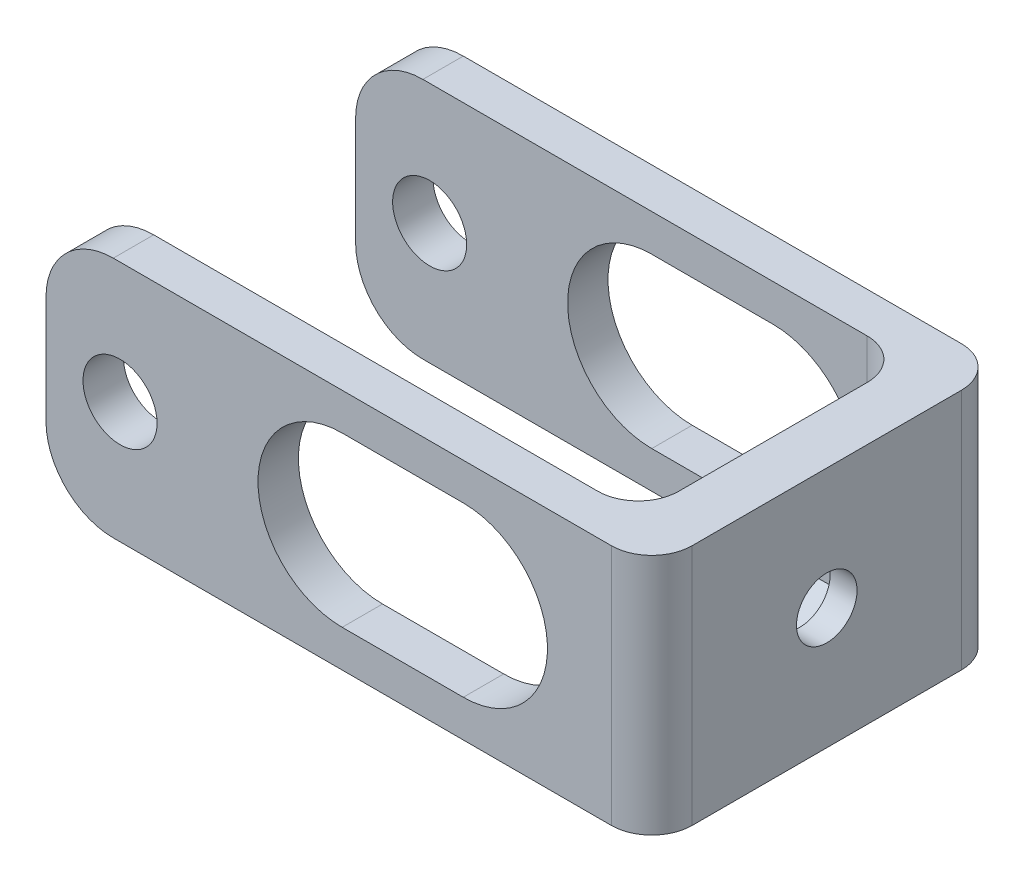
from build123d import *

# Parameters (mm, degrees)
SKETCH1_W           = 26
SKETCH1_H           = 18
BOSS_EXTRUDE1_DEPTH = 4
SKETCH2_W           = 3
SKETCH2_H           = 18
BOSS_EXTRUDE2_DEPTH = 41
SKETCH3_R           = 2.75
CUT_EXTRUDE1_DEPTH  = 50.376107583
FILLET1_R           = 3
FILLET2_R           = 5
SKETCH5_R           = 7
BOSS_EXTRUDE3_DEPTH = 2
CUT_EXTRUDE3_REACH  = 49.697
SKETCH7_R           = 2.25
CUT_EXTRUDE4_DEPTH  = 4
CHAMFER1_SIZE       = 2
CUT_EXTRUDE5_DEPTH  = 50.376107601


with BuildPart() as part:
    # Sketch1 → Boss-Extrude1 (new body)
    with BuildSketch(Plane(origin=(0, 0, 0), x_dir=(0, 0, -1), z_dir=(1, 0, 0))):
        Rectangle(SKETCH1_W, SKETCH1_H)
    extrude(amount=BOSS_EXTRUDE1_DEPTH)

    # Sketch2 → Boss-Extrude2 (add)
    with BuildSketch(Plane.ZY):
        with Locations((-11.5, 0)):
            Rectangle(SKETCH2_W, SKETCH2_H)
        with Locations((11.5, 0)):
            Rectangle(SKETCH2_W, SKETCH2_H)
    extrude(amount=BOSS_EXTRUDE2_DEPTH)

    # Sketch3 → Cut-Extrude1 (cut, through all)
    with BuildSketch(Plane.XY.offset(13)):
        with Locations((-35.5, 0)):
            Circle(SKETCH3_R)
    extrude(amount=-CUT_EXTRUDE1_DEPTH, mode=Mode.SUBTRACT)

    # Fillet1
    fillet1_edges = [part.edges().sort_by_distance(p)[0] for p in [
        (4, 0, 13),
        (0, 0, -10),
        (0, 0, 10),
        (4, 0, -13),
    ]]
    fillet(fillet1_edges, radius=FILLET1_R)

    # Fillet2
    fillet2_edges = [part.edges().sort_by_distance(p)[0] for p in [
        (-41, -9, -11.5),
        (-41, 9, -11.5),
        (-41, 9, 11.5),
        (-41, -9, 11.5),
    ]]
    fillet(fillet2_edges, radius=FILLET2_R)

    # Sketch5 → Boss-Extrude3 (add)
    with BuildSketch(Plane.ZY):
        Circle(SKETCH5_R)
    extrude(amount=BOSS_EXTRUDE3_DEPTH)

    # Sketch7 → Cut-Extrude3 (cut, up to next)
    with BuildSketch(Plane(origin=(4, 0, 0), x_dir=(0, 0, -1), z_dir=(1, 0, 0)), mode=Mode.PRIVATE) as cut_extrude3_sk1:
        Circle(SKETCH7_R)
    cut_extrude3_tool1 = extrude(cut_extrude3_sk1.sketch, amount=-CUT_EXTRUDE3_REACH, mode=Mode.PRIVATE) & part.part
    add(cut_extrude3_tool1.solids().sort_by_distance((4, 0, 0))[0], mode=Mode.SUBTRACT)

    # Sketch8 → Cut-Extrude4 (cut)
    with BuildSketch(Plane.ZY.offset(2)):
        Polygon((0, 4.330127019), (-3.75, 2.165063509), (-3.75, -2.165063509), (0, -4.330127019), (3.75, -2.165063509), (3.75, 2.165063509), align=None)
    extrude(amount=-CUT_EXTRUDE4_DEPTH, mode=Mode.SUBTRACT)

    # Chamfer1
    # the kernel refuses this chamfer: 2 mm, written as the material it adds along each edge
    with BuildSketch(Plane(origin=(0, 0, 0), x_dir=(0, 0, 1), z_dir=(0, -1, 0))) as chamfer1_piece_1_section:
        Polygon((7 + CHAMFER1_SIZE, 0), (7, CHAMFER1_SIZE), (7, 0), align=None)
    chamfer1_piece_1 = revolve(axis=Axis((0, 0, 0), (-1, 0, 0)), revolution_arc=180.000000041, mode=Mode.PRIVATE)
    chamfer1_piece_1 = split(chamfer1_piece_1, bisect_by=Plane(origin=(-0.945175713, 9, -3e-09), z_dir=(0, -1, 0)), keep=Keep.TOP, mode=Mode.PRIVATE)
    chamfer1_piece_1 = split(chamfer1_piece_1, bisect_by=Plane(origin=(-2, 8.001744255, -3e-09), z_dir=(1, 0, 0)), keep=Keep.TOP, mode=Mode.PRIVATE)
    add(chamfer1_piece_1)
    with BuildSketch(Plane(origin=(0, 0, 0), x_dir=(0, -7.23525117256177e-10, -1.0), z_dir=(0, 1.0, -7.23525117256177e-10))) as chamfer1_piece_2_section:
        Polygon((7 + CHAMFER1_SIZE, 0), (7, CHAMFER1_SIZE), (7, 0), align=None)
    chamfer1_piece_2 = revolve(axis=Axis((0, 0, 0), (-1, 0, 0)), revolution_arc=179.999999959, mode=Mode.PRIVATE)
    chamfer1_piece_2 = split(chamfer1_piece_2, bisect_by=Plane(origin=(-0.945175715, -9, 3e-09), z_dir=(0, 1, 0)), keep=Keep.TOP, mode=Mode.PRIVATE)
    chamfer1_piece_2 = split(chamfer1_piece_2, bisect_by=Plane(origin=(-2, -8.001744258, 3e-09), z_dir=(1, 0, 0)), keep=Keep.TOP, mode=Mode.PRIVATE)
    add(chamfer1_piece_2)

    # Sketch9 → Cut-Extrude5 (cut, through all)
    with BuildSketch(Plane.XY.offset(13)):
        with BuildLine():
            Line((-19, 6.25), (-10, 6.25))
            ThreePointArc((-10, 6.25), (-3.75, 0), (-10, -6.25))
            Line((-10, -6.25), (-19, -6.25))
            ThreePointArc((-19, -6.25), (-25.25, 0), (-19, 6.25))
        make_face()
    extrude(amount=-CUT_EXTRUDE5_DEPTH, mode=Mode.SUBTRACT)


solid = part.part
